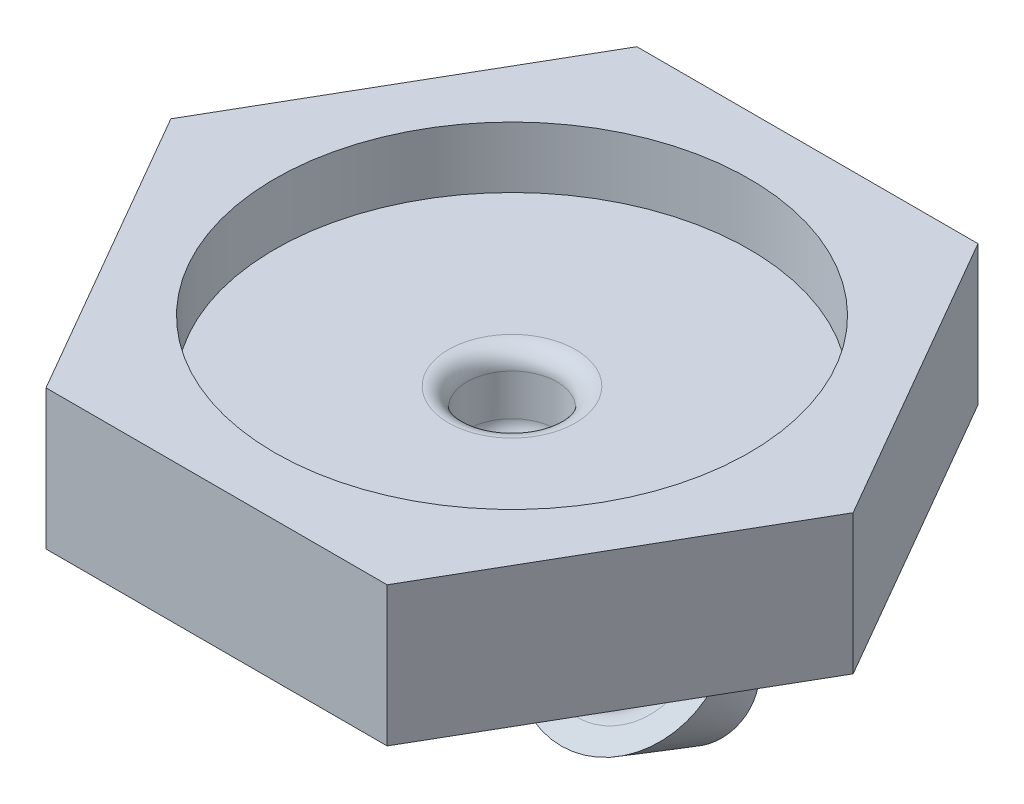
from build123d import *

# Parameters (mm, degrees)
MAINHOLDER_DEPTH   = 7.5
SKETCH12_R         = 12.75
MAGNETCUTOUT_DEPTH = 3.28
MAGNETHOLE_REACH   = 26.614
SKETCH13_R         = 2.415
DRAINOPENING_R     = 2.5
DRAINOPENING_R_2   = 1.125
DRAINBASEFILLET_R  = 2
BARBBASEFILLET_R   = 1
DRAINOPENFILLET_R  = 1
MAGNETFILLET_R     = 1


with BuildPart() as part:
    # Sketch11 → MainHolder (new body)
    with BuildSketch(Plane(origin=(0, 0, 0), x_dir=(1, 0, 0), z_dir=(0, 1, 0))):
        Polygon((18.330871047, 0), (9.165435523, 15.875), (-9.165435523, 15.875), (-18.330871047, 0), (-9.165435523, -15.875), (9.165435523, -15.875), align=None)
    extrude(amount=MAINHOLDER_DEPTH)

    # Sketch12 → MagnetCutout (cut)
    with BuildSketch(Plane(origin=(0, 7.5, 0), x_dir=(1, 0, 0), z_dir=(0, 1, 0))):
        with Locations(Location((0, 0, 0), (0, 0, 270))):
            Circle(SKETCH12_R)
    extrude(amount=-MAGNETCUTOUT_DEPTH, mode=Mode.SUBTRACT)

    # Sketch13 → MagnetHole (cut, up to next)
    with BuildSketch(Plane(origin=(0, 4.22, 0), x_dir=(1, 0, 0), z_dir=(0, 1, 0)), mode=Mode.PRIVATE) as magnethole_sk1:
        with Locations(Location((0, 0, 0), (0, 0, 270))):
            Circle(SKETCH13_R)
    magnethole_tool1 = extrude(magnethole_sk1.sketch, amount=-MAGNETHOLE_REACH, mode=Mode.PRIVATE) & part.part
    add(magnethole_tool1.solids().sort_by_distance((0, 4.22, 0))[0], mode=Mode.SUBTRACT)

    # Drain: sweep along a path in DrainPath
    with BuildLine(Plane(origin=(0, 0, 0), x_dir=(0, 0, -1), z_dir=(1, 0, 0))) as drain_path:
        Line((0, 0), (0, -2))
        ThreePointArc((0, -2), (0.456722805, -4.296100594), (1.757359313, -6.242640687))
        Line((1.757359313, -6.242640687), (10.242640687, -14.727922061))
    # DrainOpening → Drain (sweep)
    with BuildSketch(Plane.XZ):
        Circle(DRAINOPENING_R)
        Circle(DRAINOPENING_R_2, mode=Mode.SUBTRACT)
    sweep(path=drain_path.line)

    # BarbOutline → Barb (revolve)
    with BuildSketch(Plane(origin=(0, 0, 0), x_dir=(0, -0.7071067811865461, -0.7071067811865489), z_dir=(-1, 0, 0)), mode=Mode.PRIVATE) as barb_sk:
        Polygon((17.656854249, 0.671572875), (11.656854249, 0.671572875), (11.656854249, -1.578427125), align=None)
    revolve(barb_sk.sketch.rotate(Axis((0, -5.447145558, -0.961864184), (0, -0.7071067811865461, -0.707106781186549)), 180), axis=Axis((0, -5.447145558, -0.961864184), (0, -0.7071067811865461, -0.707106781186549)))

    # DrainBaseFillet
    drainbasefillet_edges = [part.edges().sort_by_distance(p)[0] for p in [
        (-2.5, 0, 0),
    ]]
    fillet(drainbasefillet_edges, radius=DRAINBASEFILLET_R - 0.0001)  # a hair under: the kernel refuses the full size

    # BarbBaseFillet
    barbbasefillet_edges = [part.edges().sort_by_distance(p)[0] for p in [
        (-2.5, -10.485281374, -6),
    ]]
    fillet(barbbasefillet_edges, radius=BARBBASEFILLET_R)

    # DrainOpenFillet
    drainopenfillet_edges = [part.edges().sort_by_distance(p)[0] for p in [
        (0, 0, -2.415),
    ]]
    fillet(drainopenfillet_edges, radius=DRAINOPENFILLET_R)

    # MagnetFillet
    magnetfillet_edges = [part.edges().sort_by_distance(p)[0] for p in [
        (0, 4.22, -2.415),
    ]]
    fillet(magnetfillet_edges, radius=MAGNETFILLET_R)


solid = part.part
